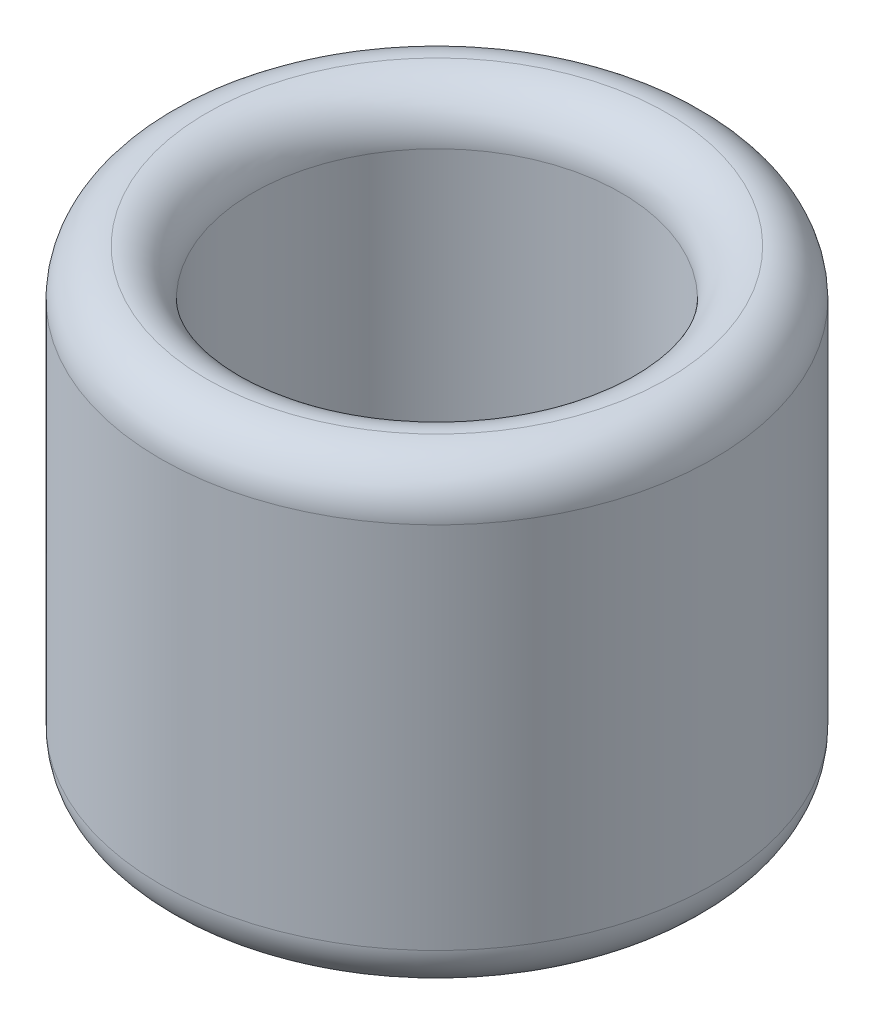
from build123d import *

# Parameters (mm, degrees)
SKETCH_1_R      = 6
SKETCH_1_R_2    = 4
EXTRUDE_1_DEPTH = 10
FILLET_1_R      = 1


with BuildPart() as part:
    # Эскиз1 → Бобышка-Вытянуть1 (new body)
    with BuildSketch(Plane(origin=(0, 0, 0), x_dir=(1, 0, 0), z_dir=(0, 1, 0))):
        with Locations(Location((0, 0, 0), (0, 0, 270))):
            Circle(SKETCH_1_R)
        with Locations(Location((0, 0, 0), (0, 0, 270))):
            Circle(SKETCH_1_R_2, mode=Mode.SUBTRACT)
    extrude(amount=EXTRUDE_1_DEPTH)

    # 圆角1
    fillet_1_edges = [part.edges().sort_by_distance(p)[0] for p in [
        (0, 0, -6),
        (0, 10, -6),
        (0, 0, -4),
        (0, 10, -4),
    ]]
    fillet(fillet_1_edges, radius=FILLET_1_R - 0.0001)  # a hair under: the kernel refuses the full size


solid = part.part
